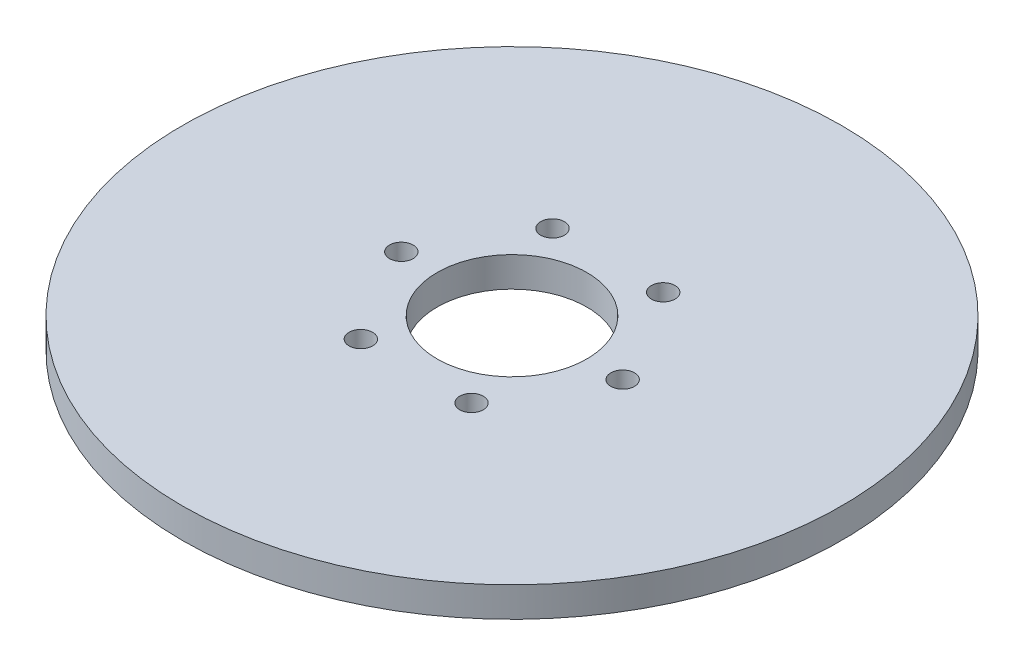
from build123d import *

# Parameters (mm, degrees)
SKETCH1_R           = 55
BOSS_EXTRUDE1_DEPTH = 5
SKETCH2_R           = 12.5
CUT_EXTRUDE1_DEPTH  = 78.942286341
SKETCH3_R           = 1.972385868
CUT_EXTRUDE2_DEPTH  = 3.306285454
CIRPATTERN1_COUNT   = 6


with BuildPart() as part:
    # Sketch1 → Boss-Extrude1 (new body)
    with BuildSketch(Plane(origin=(0, 0, 0), x_dir=(1, 0, 0), z_dir=(0, 1, 0))):
        Circle(SKETCH1_R)
    extrude(amount=BOSS_EXTRUDE1_DEPTH)

    # Sketch2 → Cut-Extrude1 (cut, through all)
    with BuildSketch(Plane(origin=(0, 0, 0), x_dir=(1, 0, 0), z_dir=(0, 1, 0))):
        Circle(SKETCH2_R)
    extrude(amount=CUT_EXTRUDE1_DEPTH, mode=Mode.SUBTRACT)

    # Sketch3 → Cut-Extrude2 (cut)
    with BuildSketch(Plane(origin=(0, 5, 0), x_dir=(1, 0, 0), z_dir=(0, 1, 0))):
        with Locations((-18.468726212, 0)):
            Circle(SKETCH3_R)
    cut_extrude2 = extrude(amount=-CUT_EXTRUDE2_DEPTH, mode=Mode.SUBTRACT)

    # CirPattern1: Cut-Extrude2 ×6 about axis
    cirpattern1_axis = Axis((0, 0, 0), (0, 1, 0))
    for i in range(1, CIRPATTERN1_COUNT):
        add(cut_extrude2.rotate(cirpattern1_axis, i * 360 / CIRPATTERN1_COUNT), mode=Mode.SUBTRACT)


solid = part.part
